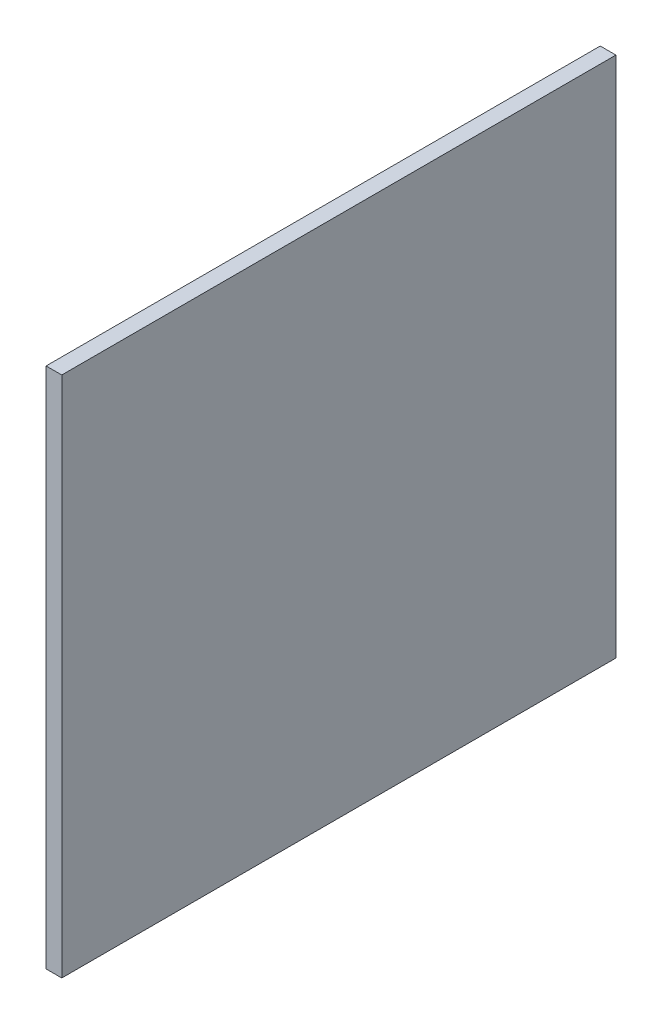
from build123d import *

# Parameters (mm, degrees)
SKETCH1_W           = 200
SKETCH1_H           = 212.22
BOSS_EXTRUDE1_DEPTH = 6


with BuildPart() as part:
    # Sketch1 → Boss-Extrude1 (new body)
    with BuildSketch(Plane.YZ):
        Rectangle(SKETCH1_W, SKETCH1_H)
    extrude(amount=BOSS_EXTRUDE1_DEPTH)


solid = part.part
